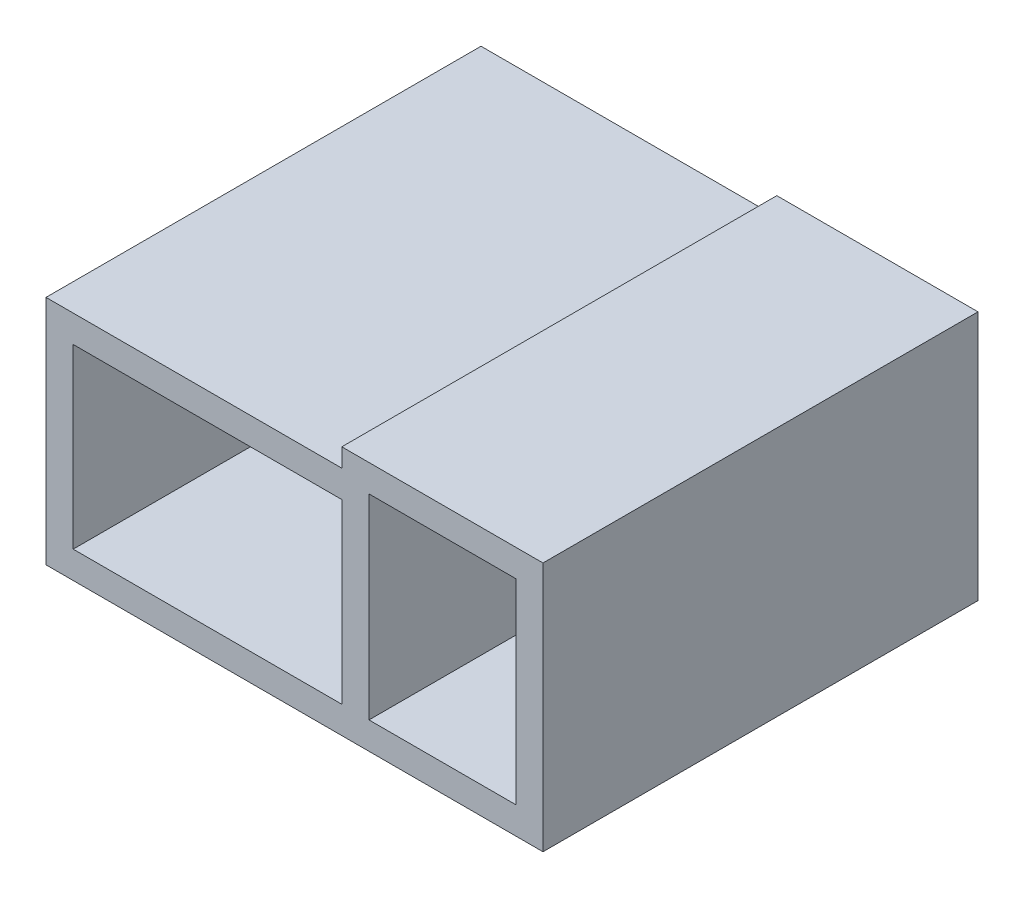
from build123d import *

# Parameters (mm, degrees)
SKETCH1_W           = 62.738
SKETCH1_H           = 41.402
SKETCH1_W_2         = 34.29
SKETCH1_H_2         = 45.72
BOSS_EXTRUDE1_DEPTH = 101.6


with BuildPart() as part:
    # Sketch1 → Boss-Extrude1 (new body)
    with BuildSketch(Plane.XY):
        Polygon((0, 54.102), (0, 0), (116.078, 0), (116.078, 6.35), (116.078, 58.42), (69.088, 58.42), (69.088, 54.102), align=None)
        with Locations((37.719, 27.051)):
            Rectangle(SKETCH1_W, SKETCH1_H, mode=Mode.SUBTRACT)
        with Locations((92.583, 29.21)):
            Rectangle(SKETCH1_W_2, SKETCH1_H_2, mode=Mode.SUBTRACT)
    extrude(amount=BOSS_EXTRUDE1_DEPTH)


solid = part.part
